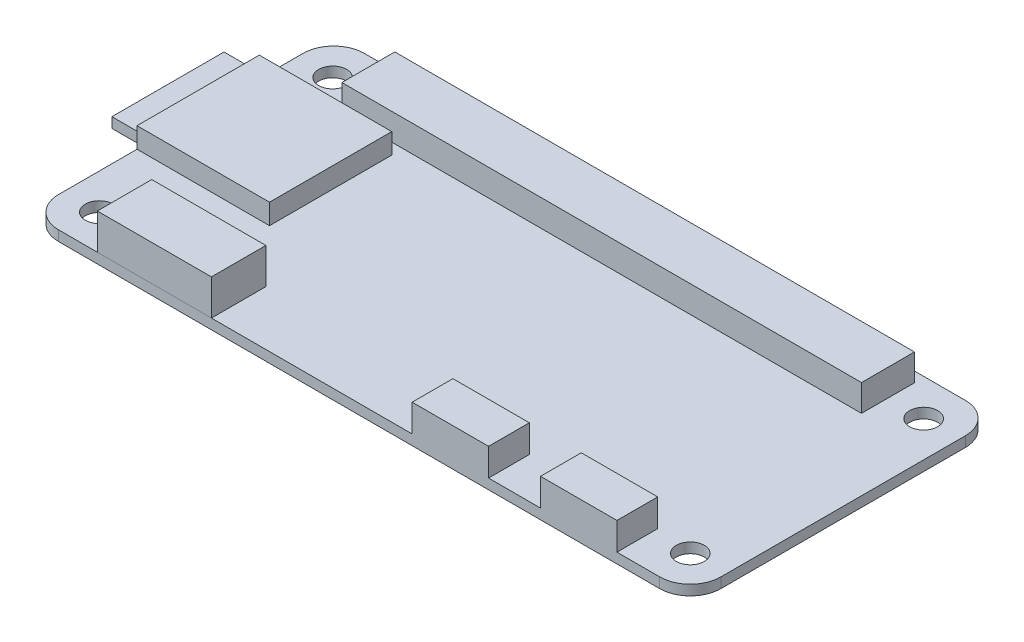
from build123d import *

# Parameters (mm, degrees)
SKETCH_1_R      = 1.375
EXTRUDE_1_DEPTH = 1
SKETCH_2_W      = 7.5
SKETCH_2_H      = 4
EXTRUDE_2_DEPTH = 2.7
SKETCH_3_W      = 11.2
SKETCH_3_H      = 5.343091965
EXTRUDE_3_DEPTH = 3.5
SKETCH_4_W      = 13
SKETCH_4_H      = 12
EXTRUDE_4_DEPTH = 2
SKETCH_5_W      = 16
SKETCH_5_H      = 11
EXTRUDE_5_DEPTH = 1
SKETCH_6_W      = 51
SKETCH_6_H      = 5.2
EXTRUDE_6_DEPTH = 2.62


with BuildPart() as part:
    # 草图1 → 凸台-拉伸1 (new body)
    with BuildSketch(Plane(origin=(0, 0, 0), x_dir=(1, 0, 0), z_dir=(0, 1, 0))):
        with BuildLine():
            Line((-32.5, 12), (-32.5, -12))
            ThreePointArc((-32.5, -12), (-31.621320344, -14.121320344), (-29.5, -15))
            Line((-29.5, -15), (29.5, -15))
            ThreePointArc((29.5, -15), (31.621320344, -14.121320344), (32.5, -12))
            Line((32.5, -12), (32.5, 12))
            ThreePointArc((32.5, 12), (31.621320344, 14.121320344), (29.5, 15))
            Line((29.5, 15), (-29.5, 15))
            ThreePointArc((-29.5, 15), (-31.621320344, 14.121320344), (-32.5, 12))
        make_face()
        with Locations((29, 11.4)):
            Circle(SKETCH_1_R, mode=Mode.SUBTRACT)
        with Locations((29, -11.5)):
            Circle(SKETCH_1_R, mode=Mode.SUBTRACT)
        with Locations((-29, -11.5)):
            Circle(SKETCH_1_R, mode=Mode.SUBTRACT)
        with Locations((-29, 11.4)):
            Circle(SKETCH_1_R, mode=Mode.SUBTRACT)
    extrude(amount=EXTRUDE_1_DEPTH)

    # 草图2 → 凸台-拉伸2 (add)
    with BuildSketch(Plane(origin=(0, 1, 0), x_dir=(1, 0, 0), z_dir=(0, 1, 0))):
        with Locations((21.55, -13)):
            Rectangle(SKETCH_2_W, SKETCH_2_H)
        with Locations((8.95, -13)):
            Rectangle(SKETCH_2_W, SKETCH_2_H)
    extrude(amount=EXTRUDE_2_DEPTH)

    # 草图6 → 凸台-拉伸6 (add)
    with BuildSketch(Plane(origin=(0, 1, 0), x_dir=(1, 0, 0), z_dir=(0, 1, 0))):
        with Locations((0, 11.4)):
            Rectangle(SKETCH_6_W, SKETCH_6_H)
    extrude(amount=EXTRUDE_6_DEPTH)


with BuildPart() as body_2:
    # 草图3 → 凸台-拉伸3 (new body)
    with BuildSketch(Plane(origin=(0, 1, 0), x_dir=(1, 0, 0), z_dir=(0, 1, 0))):
        with Locations((-20.1, -12.328454018)):
            Rectangle(SKETCH_3_W, SKETCH_3_H)
    extrude(amount=EXTRUDE_3_DEPTH)


with BuildPart() as body_3:
    # 草图4 → 凸台-拉伸4 (new body)
    with BuildSketch(Plane(origin=(0, 1, 0), x_dir=(1, 0, 0), z_dir=(0, 1, 0))):
        with Locations((-26, 1.7)):
            Rectangle(SKETCH_4_W, SKETCH_4_H)
    extrude(amount=EXTRUDE_4_DEPTH)

    # 草图5 → 凸台-拉伸5 (add)
    with BuildSketch(Plane(origin=(0, 1, 0), x_dir=(1, 0, 0), z_dir=(0, 1, 0))):
        with Locations((-27.5, 1.732869615)):
            Rectangle(SKETCH_5_W, SKETCH_5_H)
    extrude(amount=EXTRUDE_5_DEPTH)


solid = Compound([part.part, body_2.part, body_3.part])
